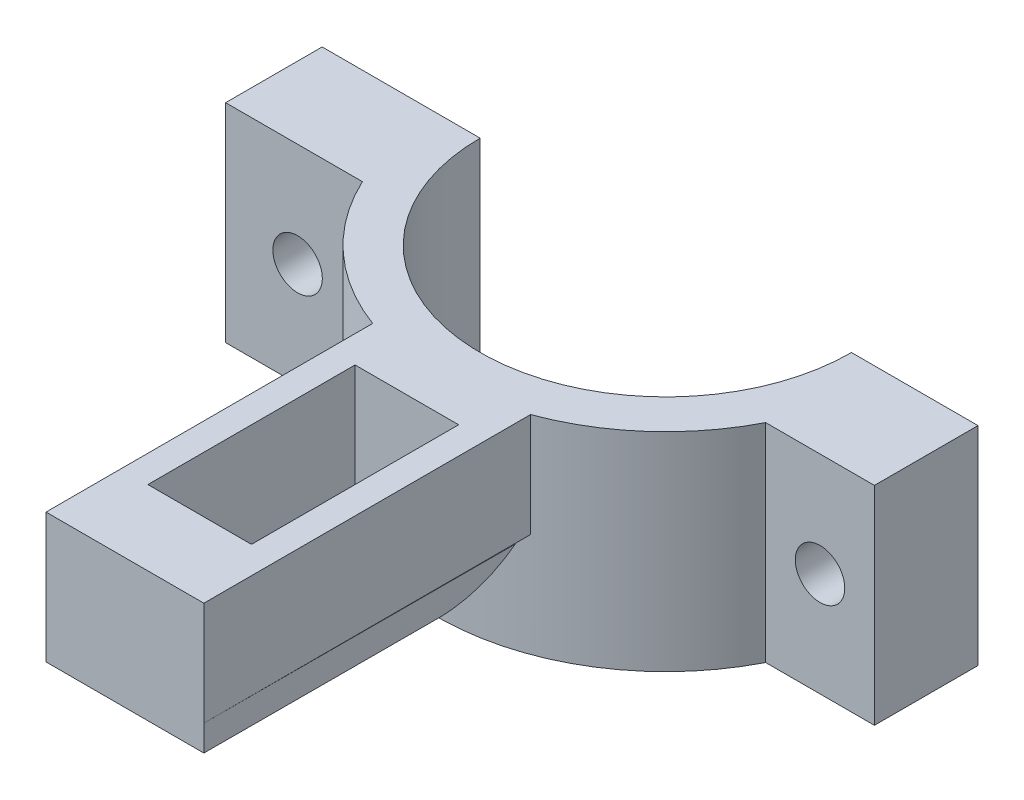
from build123d import *

# Parameters (mm, degrees)
SKETCH_1_R             = 17.63
SKETCH_1_R_2           = 14.34
EXTRUDE_1_DEPTH        = 16.05
EXTRUDE_1_2_DEPTH      = 9.77
EXTRUDE_1_2_DEPTH_BACK = 3
SKETCH_2_W             = 16
SKETCH_2_H             = 16.05
SKETCH_3_W             = 3.41
SKETCH_3_H             = 16
CUT_EXTRUDE_1_DEPTH    = 37.411121927
SKETCH_4_R             = 1.91
CUT_EXTRUDE_2_DEPTH    = 39.675463798
EXTRUDE_2_DEPTH        = 4
EXTRUDE_2_DEPTH_BACK   = 2.77
SKETCH_5_W             = 12.19
SKETCH_5_H             = 8.263625949
SKETCH_6_W             = 12.19
SKETCH_6_H             = 6.77
EXTRUDE_3_DEPTH        = 63
SKETCH_8_W             = 12.19
SKETCH_8_H             = 6.77
EXTRUDE_4_DEPTH        = 0.16
EXTRUDE_5_DEPTH        = 3.16
EXTRUDE_5_DEPTH_BACK   = 10
SKETCH_12_W            = 16
SKETCH_12_H            = 16.05
SKETCH_13_W            = 1.21
SKETCH_13_H            = 16
CUT_EXTRUDE_3_DEPTH    = 73.543164889
SKETCH_14_R            = 1.91
CUT_EXTRUDE_4_DEPTH    = 90.07387176
SKETCH_15_R            = 4.05
CUT_EXTRUDE_5_DEPTH    = 24
SKETCH_16_W            = 56.400519221
SKETCH_16_H            = 19.935010357
CUT_EXTRUDE_6_DEPTH    = 73.088971918
SKETCH_17_W            = 12.19
SKETCH_17_H            = 71.423625949
EXTRUDE_7_DEPTH        = 25
SKETCH_18_W            = 26.793372528
SKETCH_18_H            = 63.398625949
CUT_EXTRUDE_7_DEPTH    = 25
SKETCH_19_R            = 4
CUT_EXTRUDE_8_DEPTH    = 24
CUT_EXTRUDE_9_DEPTH    = 29
SKETCH_21_W            = 8
SKETCH_21_H            = 16
CUT_EXTRUDE_10_DEPTH   = 8
EXTRUDE_9_DEPTH        = 2
FILLET_1_R             = 10


with BuildPart() as part:
    # 草圖1 → Extrude 1 (new body)
    with BuildSketch(Plane(origin=(0, 0, 0), x_dir=(1, 0, 0), z_dir=(0, 1, 0))):
        Circle(SKETCH_1_R)
        Circle(SKETCH_1_R_2, mode=Mode.SUBTRACT)
    extrude(amount=EXTRUDE_1_DEPTH)

    # 草圖2 → Extrude 1 2 (add, two sides: drawn at the far end of the back side and taken through both)
    with BuildSketch(Plane(origin=(17.75, 0, 0), x_dir=(0, 0, -1), z_dir=(1, 0, 0)).offset(-EXTRUDE_1_2_DEPTH_BACK)):
        with Locations((0, 8.025)):
            Rectangle(SKETCH_2_W, SKETCH_2_H)
    extrude(amount=EXTRUDE_1_2_DEPTH + EXTRUDE_1_2_DEPTH_BACK)

    # 草圖3 → 除料-伸長1 (cut, through all)
    with BuildSketch(Plane(origin=(0, 16.05, 0), x_dir=(1, 0, 0), z_dir=(0, 1, 0))):
        with Locations((25.815, 0)):
            Rectangle(SKETCH_3_W, SKETCH_3_H)
    extrude(amount=-CUT_EXTRUDE_1_DEPTH, mode=Mode.SUBTRACT)

    # 草圖4 → 除料-伸長2 (cut, through all)
    with BuildSketch(Plane.XY.offset(8)):
        with Locations((19.910203689, 8.025)):
            Circle(SKETCH_4_R)
    extrude(amount=-CUT_EXTRUDE_2_DEPTH, mode=Mode.SUBTRACT)

    # 草圖5 → 填料-伸長2 (add, two sides: drawn at the far end of the back side and taken through both)
    with BuildSketch(Plane.XY.offset(17.75).offset(-EXTRUDE_2_DEPTH_BACK)):
        with Locations((0, 12.156812974)):
            Rectangle(SKETCH_5_W, SKETCH_5_H)
    extrude(amount=EXTRUDE_2_DEPTH + EXTRUDE_2_DEPTH_BACK)

    # 草圖6 → 填料-伸長3 (add)
    with BuildSketch(Plane(origin=(0, 16.288625949, 0), x_dir=(1, 0, 0), z_dir=(0, 1, 0))):
        with Locations((0, -18.365)):
            Rectangle(SKETCH_6_W, SKETCH_6_H)
    extrude(amount=EXTRUDE_3_DEPTH)

    # 草圖8 → 填料-伸長4 (add)
    with BuildSketch(Plane(origin=(0, 79.288625949, 0), x_dir=(1, 0, 0), z_dir=(0, 1, 0))):
        with Locations((0, -18.365)):
            Rectangle(SKETCH_8_W, SKETCH_8_H)
    extrude(amount=EXTRUDE_4_DEPTH)

    # 草圖12 → 填料-伸長5 (add, two sides: drawn at the far end of the back side and taken through both)
    with BuildSketch(Plane(origin=(-17.75, 0, 0), x_dir=(0, 0, -1), z_dir=(1, 0, 0)).offset(-EXTRUDE_5_DEPTH_BACK)):
        with Locations((0.543544944, 8.025)):
            Rectangle(SKETCH_12_W, SKETCH_12_H)
    extrude(amount=EXTRUDE_5_DEPTH + EXTRUDE_5_DEPTH_BACK)

    # 草圖13 → 除料-伸長3 (cut, through all)
    with BuildSketch(Plane(origin=(0, 16.05, 0), x_dir=(1, 0, 0), z_dir=(0, 1, 0))):
        with Locations((-27.145, 0.543544944)):
            Rectangle(SKETCH_13_W, SKETCH_13_H)
    extrude(amount=-CUT_EXTRUDE_3_DEPTH, mode=Mode.SUBTRACT)

    # 草圖14 → 除料-伸長4 (cut, through all)
    with BuildSketch(Plane(origin=(0, 0, -8.543544944), x_dir=(-1, 0, 0), z_dir=(0, 0, -1))):
        with Locations(Location((20.980783679, 8.025, 0), (0, 0, 90))):
            Circle(SKETCH_14_R)
    extrude(amount=-CUT_EXTRUDE_4_DEPTH, mode=Mode.SUBTRACT)

    # 草圖15 → 除料-伸長5 (cut)
    with BuildSketch(Plane(origin=(0, 79.448625949, 0), x_dir=(1, 0, 0), z_dir=(0, 1, 0))):
        with Locations((0, -14.98)):
            Circle(SKETCH_15_R)
    extrude(amount=-CUT_EXTRUDE_5_DEPTH, mode=Mode.SUBTRACT)

    # 草圖16 → 除料-伸長6 (cut, through all)
    with BuildSketch(Plane(origin=(0, 16.05, 0), x_dir=(1, 0, 0), z_dir=(0, 1, 0))):
        with Locations((-4.090259611, 9.967505179)):
            Rectangle(SKETCH_16_W, SKETCH_16_H)
    extrude(amount=-CUT_EXTRUDE_6_DEPTH, mode=Mode.SUBTRACT)

    # 草圖17 → 填料-伸長7 (add)
    with BuildSketch(Plane.XY.offset(21.75)):
        with Locations((0, 43.736812975)):
            Rectangle(SKETCH_17_W, SKETCH_17_H)
    extrude(amount=EXTRUDE_7_DEPTH)

    # 草圖18 → 除料-伸長7 (cut)
    with BuildSketch(Plane.ZY.offset(6.095)):
        with Locations((28.376686264, 47.749312975)):
            Rectangle(SKETCH_18_W, SKETCH_18_H)
    extrude(amount=-CUT_EXTRUDE_7_DEPTH, mode=Mode.SUBTRACT)

    # 草圖19 → 除料-伸長8 (cut)
    with BuildSketch(Plane(origin=(0, 79.448625949, 0), x_dir=(1, 0, 0), z_dir=(0, 1, 0))):
        with Locations((0, -41.773372528)):
            Circle(SKETCH_19_R)
    extrude(amount=-CUT_EXTRUDE_8_DEPTH, mode=Mode.SUBTRACT)

    # 草圖20 → 除料-伸長9 (cut)
    with BuildSketch(Plane(origin=(6.095, 0, 0), x_dir=(0, 0, -1), z_dir=(1, 0, 0))):
        Polygon((-41.773372528, 16.05), (-41.773372528, 8.025), (-46.75, 8.025), (-46.75, 79.448625949), (-41.773372528, 79.448625949), align=None)
    extrude(amount=-CUT_EXTRUDE_9_DEPTH, mode=Mode.SUBTRACT)

    # 草圖21 → 除料-伸長10 (cut)
    with BuildSketch(Plane(origin=(0, 16.05, 0), x_dir=(1, 0, 0), z_dir=(0, 1, 0))):
        with Locations((0, -28)):
            Rectangle(SKETCH_21_W, SKETCH_21_H)
    extrude(amount=-CUT_EXTRUDE_10_DEPTH, mode=Mode.SUBTRACT)

    # 草圖23 → 填料-伸長9 (add)
    with BuildSketch(Plane.XZ.offset(-8.025)):
        Polygon((-6.095, 41.773372528), (-6.095, 17.75), (6.13829314, 17.75), (6.095, 41.773372528), align=None)
    extrude(amount=EXTRUDE_9_DEPTH)

    # 圓角1
    # the kernel refuses this fillet: 10 mm, written as the material it takes off along each edge
    with BuildSketch(Plane(origin=(-21.095, 6.025, 17.75), x_dir=(0, 0, 1), z_dir=(1, 0, 0))) as fillet_1_piece_1:
        with BuildLine():
            CenterArc((6, -10), FILLET_1_R, 90, 36.869897646)
            Line((0, -2), (0, 0))
            Line((0, 0), (6, 0))
        make_face()
    extrude(amount=42.23329314, mode=Mode.SUBTRACT)


solid = part.part
